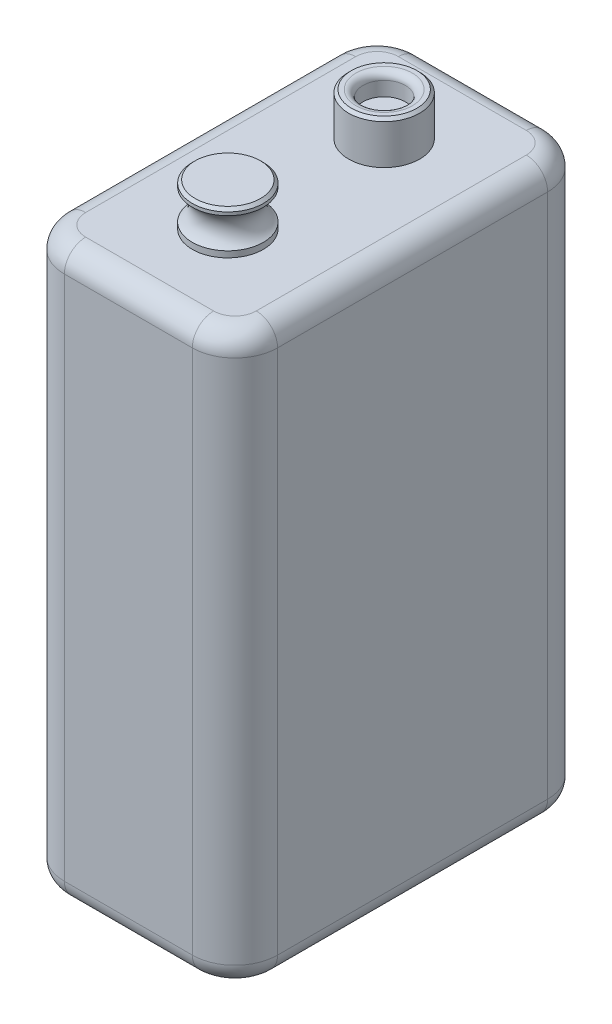
from build123d import *

# Parameters (mm, degrees)
CROQUIS1_W              = 15
CROQUIS1_H              = 25
SALIENTE_EXTRUIR1_DEPTH = 40
REDONDEO1_R             = 3
REDONDEO2_R             = 1.5
REDONDEO3_R             = 1.5
CROQUIS2_R              = 2.5
SALIENTE_EXTRUIR2_DEPTH = 3
CROQUIS3_R              = 1.487403204
CORTAR_EXTRUIR1_DEPTH   = 1.5
REDONDEO4_R             = 0.5
CHAFL_N1_SIZE           = 0.2
CROQUIS4_R              = 1.299235838
CHAFL_N2_SIZE           = 0.2


with BuildPart() as part:
    # Croquis1 → Saliente-Extruir1 (new body)
    with BuildSketch(Plane(origin=(0, 0, 0), x_dir=(1, 0, 0), z_dir=(0, 1, 0))):
        Rectangle(CROQUIS1_W, CROQUIS1_H)
    extrude(amount=SALIENTE_EXTRUIR1_DEPTH)

    # Redondeo1
    redondeo1_edges = [part.edges().sort_by_distance(p)[0] for p in [
        (-7.5, 20, -12.5),
        (7.5, 20, -12.5),
        (-7.5, 20, 12.5),
        (7.5, 20, 12.5),
    ]]
    fillet(redondeo1_edges, radius=REDONDEO1_R)

    # Redondeo2
    redondeo2_edges = [part.edges().sort_by_distance(p)[0] for p in [
        (6.621320344, 0, 11.621320344),
        (0, 0, 12.5),
        (-6.621320344, 0, 11.621320344),
        (-7.5, 0, 0),
        (-6.621320344, 0, -11.621320344),
        (0, 0, -12.5),
        (6.621320344, 0, -11.621320344),
        (7.5, 0, 0),
    ]]
    fillet(redondeo2_edges, radius=REDONDEO2_R)

    # Redondeo3
    redondeo3_edges = [part.edges().sort_by_distance(p)[0] for p in [
        (6.621320344, 40, 11.621320344),
        (0, 40, 12.5),
        (-6.621320344, 40, 11.621320344),
        (-7.5, 40, 0),
        (-6.621320344, 40, -11.621320344),
        (0, 40, -12.5),
        (6.621320344, 40, -11.621320344),
        (7.5, 40, 0),
    ]]
    fillet(redondeo3_edges, radius=REDONDEO3_R)

    # Croquis2 → Saliente-Extruir2 (add)
    with BuildSketch(Plane(origin=(0, 40, 0), x_dir=(1, 0, 0), z_dir=(0, 1, 0))):
        with Locations((0, 5.5)):
            Circle(CROQUIS2_R)
        with Locations((0, -5.5)):
            Circle(CROQUIS2_R)
    extrude(amount=SALIENTE_EXTRUIR2_DEPTH)

    # Croquis3 → Cortar-Extruir1 (cut)
    with BuildSketch(Plane(origin=(0, 43, 0), x_dir=(1, 0, 0), z_dir=(0, 1, 0))):
        with Locations((0, 5.5)):
            Circle(CROQUIS3_R)
    extrude(amount=-CORTAR_EXTRUIR1_DEPTH, mode=Mode.SUBTRACT)

    # Redondeo4
    redondeo4_edges = [part.edges().sort_by_distance(p)[0] for p in [
        (-1.487403204, 43, -5.5),
    ]]
    fillet(redondeo4_edges, radius=REDONDEO4_R)

    # Chaflán1
    chafl_n1_edges = [part.edges().sort_by_distance(p)[0] for p in [
        (-2.5, 43, -5.5),
    ]]
    chamfer(chafl_n1_edges, length=CHAFL_N1_SIZE)

    # Croquis4 → Cortar-Revolución1 (revolve, cut)
    with BuildSketch(Plane(origin=(0, 0, 0), x_dir=(0, 0, -1), z_dir=(1, 0, 0))):
        with Locations((-2.260920396, 41.5)):
            Circle(CROQUIS4_R)
    revolve(axis=Axis((0, 43, 5.5), (0, -1, 0)), mode=Mode.SUBTRACT)

    # Chaflán2
    chafl_n2_edges = [part.edges().sort_by_distance(p)[0] for p in [
        (-2.5, 43, 5.5),
    ]]
    chamfer(chafl_n2_edges, length=CHAFL_N2_SIZE)


solid = part.part
